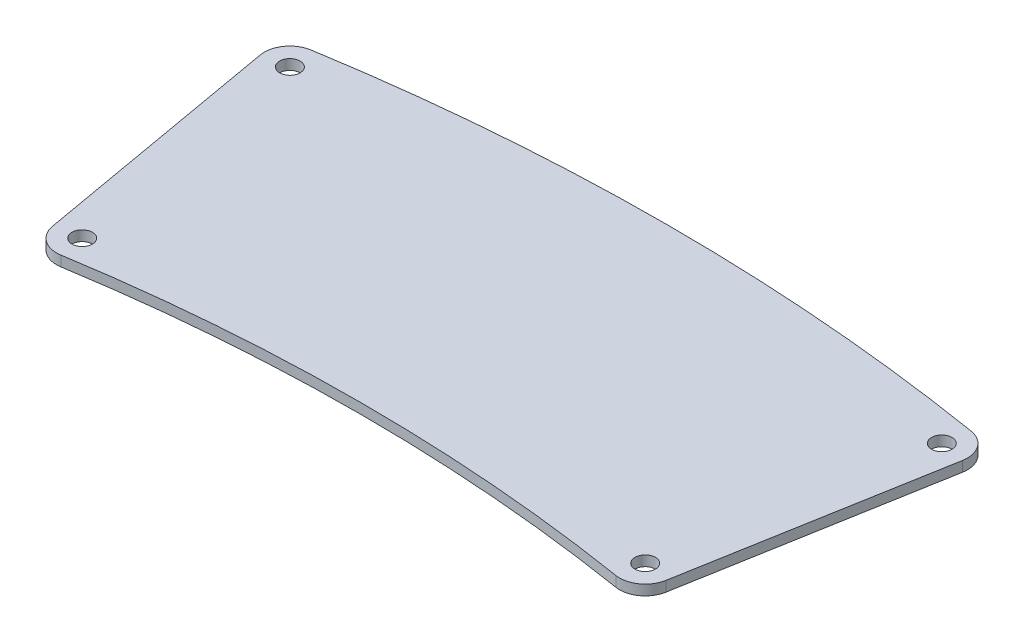
from build123d import *

# Parameters (mm, degrees)
SM_BASE_FLANGE_1_DEPTH = 2
FILLET_1_R             = 5
SKETCH_2_R             = 2
CUT_EXTRUDE_1_DEPTH    = 10


# Sheet-metal steps are written as plain solids
with BuildPart() as part:
    # Sketch 1 → Базовая кромка1 (new body)
    with BuildSketch(Plane(origin=(0, 0, 0), x_dir=(1, 0, 0), z_dir=(0, 1, 0))):
        with BuildLine():
            Line((-59.040380407, 334.834636024), (-69.459271067, 393.923101205))
            ThreePointArc((-69.459271067, 393.923101205), (0, 400), (69.459271067, 393.923101205))
            Line((69.459271067, 393.923101205), (59.040380407, 334.834636024))
            ThreePointArc((59.040380407, 334.834636024), (0, 340), (-59.040380407, 334.834636024))
        make_face()
    extrude(amount=-SM_BASE_FLANGE_1_DEPTH)

    # Скругление1
    fillet_1_edges = [part.edges().sort_by_distance(p)[0] for p in [
        (-59.040380407, -1, -334.834636024),
        (-69.459271067, -1, -393.923101205),
        (69.459271067, -1, -393.923101205),
        (59.040380407, -1, -334.834636024),
    ]]
    fillet(fillet_1_edges, radius=FILLET_1_R)

    # Эскиз2 → Вырез-Вытянуть1 (cut)
    with BuildSketch(Plane(origin=(0, 0, 0), x_dir=(1, 0, 0), z_dir=(0, 1, 0))):
        with Locations(Location((-63.661495998, 389.836137277, 0), (0, 0, 270))):
            Circle(SKETCH_2_R)
        with Locations(Location((-54.978290599, 340.591232363, 0), (0, 0, 270))):
            Circle(SKETCH_2_R)
        with Locations(Location((63.661495998, 389.836137277, 0), (0, 0, 270))):
            Circle(SKETCH_2_R)
        with Locations(Location((54.978290599, 340.591232363, 0), (0, 0, 270))):
            Circle(SKETCH_2_R)
    extrude(amount=-CUT_EXTRUDE_1_DEPTH, mode=Mode.SUBTRACT)


solid = part.part
